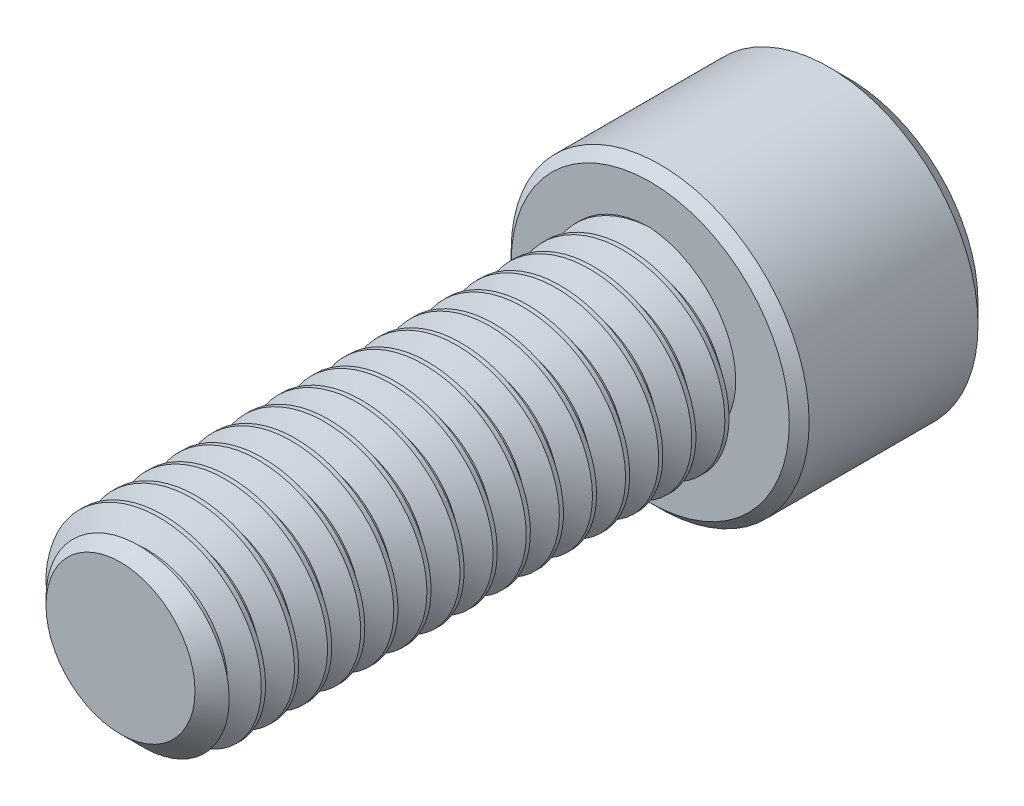
from build123d import *

# Parameters (mm, degrees)
SKETCH1_R          = 4.7625
EXTRUDE1_DEPTH     = 25.4
CHAMFER3_SIZE      = 1.190625
CUT_SWEEP1_PITCH   = 1.5875
SKETCH6_R          = 7.14375
EXTRUDE2_DEPTH     = 9.525
CUT_EXTRUDE1_DEPTH = 5.953125
SKETCH8_R          = 4.582717762
CUT_EXTRUDE2_DEPTH = 0.9525
CUT_EXTRUDE2_DRAFT = -45
CHAMFER1_SIZE      = 0.9525
CHAMFER2_SIZE      = 0.47625


with BuildPart() as part:
    # Sketch1 → Extrude1 (new body)
    with BuildSketch(Plane.XY):
        Circle(SKETCH1_R)
    extrude(amount=-EXTRUDE1_DEPTH)

    # Chamfer3
    chamfer3_edges = [part.edges().sort_by_distance(p)[0] for p in [
        (-4.7625, 0, 0),
    ]]
    chamfer(chamfer3_edges, length=CHAMFER3_SIZE)

    # Cut-Sweep1: the profile of Sketch3 profile screwed along a right-hand helix of 17 turns, 6 arcs to a turn; built about Z, then put on its axis
    cut_sweep1_z = Axis((0, 0, 0), (0, 0, 1))
    cut_sweep1_corners = [(4.7628, 0, -1.389235705), (3.731388504, 0, -0.79375), (3.731388504, 0, -0.5953125), (4.7628, 0, 0.000173205)]
    with BuildLine(mode=Mode.PRIVATE) as cut_sweep1_profile:
        Line(cut_sweep1_corners[0], cut_sweep1_corners[1])
        Line(cut_sweep1_corners[1], cut_sweep1_corners[2])
        Line(cut_sweep1_corners[2], cut_sweep1_corners[3])
        Line(cut_sweep1_corners[3], cut_sweep1_corners[0])
    cut_sweep1_cap = Face(cut_sweep1_profile.wire())
    cut_sweep1_turn_angles = [0, 30, 60, 90, 120, 150, 180, 210, 240, 270, 300, 330, 360]
    cut_sweep1_turn_weights = [1, 0.8660254037844387, 1, 0.8660254037844387, 1, 0.8660254037844387, 1, 0.8660254037844387, 1, 0.8660254037844387, 1, 0.8660254037844387, 1]
    cut_sweep1_turn_rails = [Edge.make_bspline([Vector(p[0], p[1], 0).rotate(cut_sweep1_z, cut_sweep1_turn_angles[k]) / cut_sweep1_turn_weights[k] + Vector(0, 0, p[2] + CUT_SWEEP1_PITCH * cut_sweep1_turn_angles[k] / 360) for k in range(13)], [0, 0, 0, 1, 1, 2, 2, 3, 3, 4, 4, 5, 5, 6, 6, 6], 2, cut_sweep1_turn_weights) for p in cut_sweep1_corners]
    cut_sweep1_turn_sides = [Face.make_surface_from_curves(cut_sweep1_turn_rails[p[0]], cut_sweep1_turn_rails[p[1]]) for p in [(0, 1), (1, 2), (2, 3), (3, 0)]]
    cut_sweep1 = Plane(origin=(0, 0, 0), x_dir=(0, 1, 0), z_dir=(0, 0, -1)) * Solid(Shell([*[p.moved(Location((0, 0, CUT_SWEEP1_PITCH * i))) for i in range(17) for p in cut_sweep1_turn_sides], cut_sweep1_cap, cut_sweep1_cap.rotate(cut_sweep1_z, 6120).moved(Location((0, 0, CUT_SWEEP1_PITCH * 6120 / 360)))]))
    add(cut_sweep1, mode=Mode.SUBTRACT)

    # Sketch6 → Extrude2 (add)
    with BuildSketch(Plane(origin=(0, 0, -25.4), x_dir=(-1, 0, 0), z_dir=(0, 0, -1))):
        with Locations(Location((0, 0, 0), (0, 0, 180))):
            Circle(SKETCH6_R)
    extrude(amount=EXTRUDE2_DEPTH)

    # Sketch7 → Cut-Extrude1 (cut)
    with BuildSketch(Plane(origin=(0, 0, -34.925), x_dir=(-1, 0, 0), z_dir=(0, 0, -1))):
        Polygon((0, 4.582717762), (-3.96875, 2.291358881), (-3.96875, -2.291358881), (0, -4.582717762), (3.96875, -2.291358881), (3.96875, 2.291358881), align=None)
    extrude(amount=-CUT_EXTRUDE1_DEPTH, mode=Mode.SUBTRACT)


with BuildPart() as cut_extrude2_tool:
    # Sketch8 → Cut-Extrude2 (with draft: the straight prism first)
    with BuildSketch(Plane(origin=(0, 0, -34.925), x_dir=(-1, 0, 0), z_dir=(0, 0, -1))):
        Circle(SKETCH8_R)
    extrude(amount=-CUT_EXTRUDE2_DEPTH)
    # Cut-Extrude2: the draft: its side faces are tilted about the plane it starts from
    cut_extrude2_sides = [cut_extrude2_tool.faces().sort_by_distance(p)[0] for p in [
        (4.582717762, 0, -34.44875),
    ]]
    draft(cut_extrude2_sides, Plane(origin=(0, 0, -34.925), x_dir=(-1, 0, 0), z_dir=(0, 0, -1)), CUT_EXTRUDE2_DRAFT)


with BuildPart() as part_1:
    add(part.part)

    # Cut-Extrude2: cut by cut_extrude2_tool
    add(cut_extrude2_tool.part, mode=Mode.SUBTRACT)

    # Chamfer1
    chamfer1_edges = [part_1.edges().sort_by_distance(p)[0] for p in [
        (-7.14375, 0, -34.925),
    ]]
    chamfer(chamfer1_edges, length=CHAMFER1_SIZE)

    # Chamfer2
    chamfer2_edges = [part_1.edges().sort_by_distance(p)[0] for p in [
        (-7.14375, 0, -25.4),
    ]]
    chamfer(chamfer2_edges, length=CHAMFER2_SIZE)


solid = part_1.part
